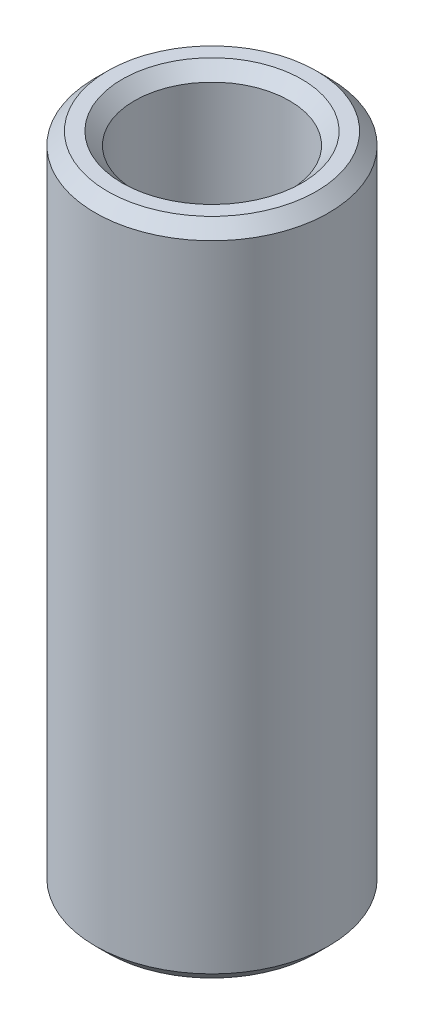
from build123d import *

# Parameters (mm, degrees)
SKETCH1_R           = 27.5
BOSS_EXTRUDE1_DEPTH = 155.341796822
SKETCH2_R           = 18.25157711
CUT_EXTRUDE1_DEPTH  = 161.136110355
CHAMFER1_SIZE       = 2.915680523


with BuildPart() as part:
    # Sketch1 → Boss-Extrude1 (new body)
    with BuildSketch(Plane(origin=(0, 0, 0), x_dir=(1, 0, 0), z_dir=(0, 1, 0))):
        Circle(SKETCH1_R)
    extrude(amount=BOSS_EXTRUDE1_DEPTH)

    # Sketch2 → Cut-Extrude1 (cut, through all)
    with BuildSketch(Plane(origin=(0, 0, 0), x_dir=(1, 0, 0), z_dir=(0, 1, 0))):
        Circle(SKETCH2_R)
    extrude(amount=CUT_EXTRUDE1_DEPTH, mode=Mode.SUBTRACT)

    # Chamfer1
    chamfer1_edges = [part.edges().sort_by_distance(p)[0] for p in [
        (-18.25157711, 155.341796822, 0),
        (-18.25157711, 0, 0),
        (-27.5, 0, 0),
        (-27.5, 155.341796822, 0),
    ]]
    chamfer(chamfer1_edges, length=CHAMFER1_SIZE)


solid = part.part
